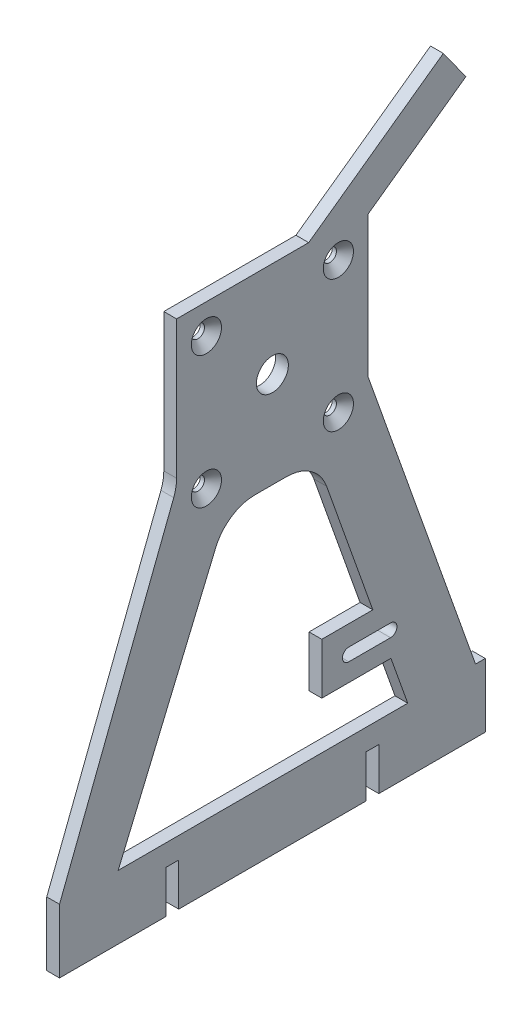
from build123d import *

# Parameters (mm, degrees)
SKETCH1_R           = 1.55
SKETCH1_R_2         = 3.75
BOSS_EXTRUDE2_DEPTH = 3
CHAMFER1_SIZE       = 2
FILLET2_R           = 10


with BuildPart() as part:
    # Sketch1 → Boss-Extrude2 (new body)
    with BuildSketch(Plane(origin=(0, 0, 0), x_dir=(0, 0, -1), z_dir=(1, 0, 0))):
        Polygon((27.5, 86.038878339), (0, 15), (0, 0), (25, 0), (25, 10), (28, 10), (28, 0), (72, 0), (72, 10), (75, 10), (75, 0), (100, 0), (100, 15), (97.712949054, 15), (72.5, 85.972228566), (72.5, 119.167717934), (95.440133744, 135.626948458), (90.14613276, 143.005488448), (58.527688318, 120.31968933), (27.5, 120.31968933), align=None)
        Polygon((13.777878312, 15), (39.282646226, 75.31968933), (60.365916003, 75.31968933), (73.589912694, 38.095304601), (61.605198786, 38.095304601), (61.605198786, 26.111146138), (77.84729594, 26.111146138), (81.794540759, 15), align=None, mode=Mode.SUBTRACT)
        with BuildLine():
            ThreePointArc((67.956429084, 30.345444875), (66.456429084, 31.845444875), (67.956429084, 33.345444875))
            Line((67.956429084, 33.345444875), (77.753857358, 33.345444875))
            ThreePointArc((77.753857358, 33.345444875), (79.253857358, 31.845444875), (77.753857358, 30.345444875))
            Line((77.753857358, 30.345444875), (67.956429084, 30.345444875))
        make_face(mode=Mode.SUBTRACT)
        with Locations((65.5, 82.31968933)):
            Circle(SKETCH1_R, mode=Mode.SUBTRACT)
        with Locations((65.5, 113.31968933)):
            Circle(SKETCH1_R, mode=Mode.SUBTRACT)
        with Locations((34.5, 82.31968933)):
            Circle(SKETCH1_R, mode=Mode.SUBTRACT)
        with Locations((50, 97.81968933)):
            Circle(SKETCH1_R_2, mode=Mode.SUBTRACT)
        with Locations((34.5, 113.31968933)):
            Circle(SKETCH1_R, mode=Mode.SUBTRACT)
    extrude(amount=BOSS_EXTRUDE2_DEPTH)

    # Chamfer1
    chamfer1_edges = [part.edges().sort_by_distance(p)[0] for p in [
        (3, 82.31968933, -32.95),
        (3, 82.31968933, -63.95),
        (3, 113.31968933, -63.95),
        (3, 113.31968933, -32.95),
    ]]
    chamfer(chamfer1_edges, length=CHAMFER1_SIZE)

    # Fillet2
    fillet2_edges = [part.edges().sort_by_distance(p)[0] for p in [
        (1.5, 75.31968933, -60.365916003),
        (1.5, 75.31968933, -39.282646226),
        (1.5, 86.038878339, -27.5),
    ]]
    fillet(fillet2_edges, radius=FILLET2_R)


solid = part.part
